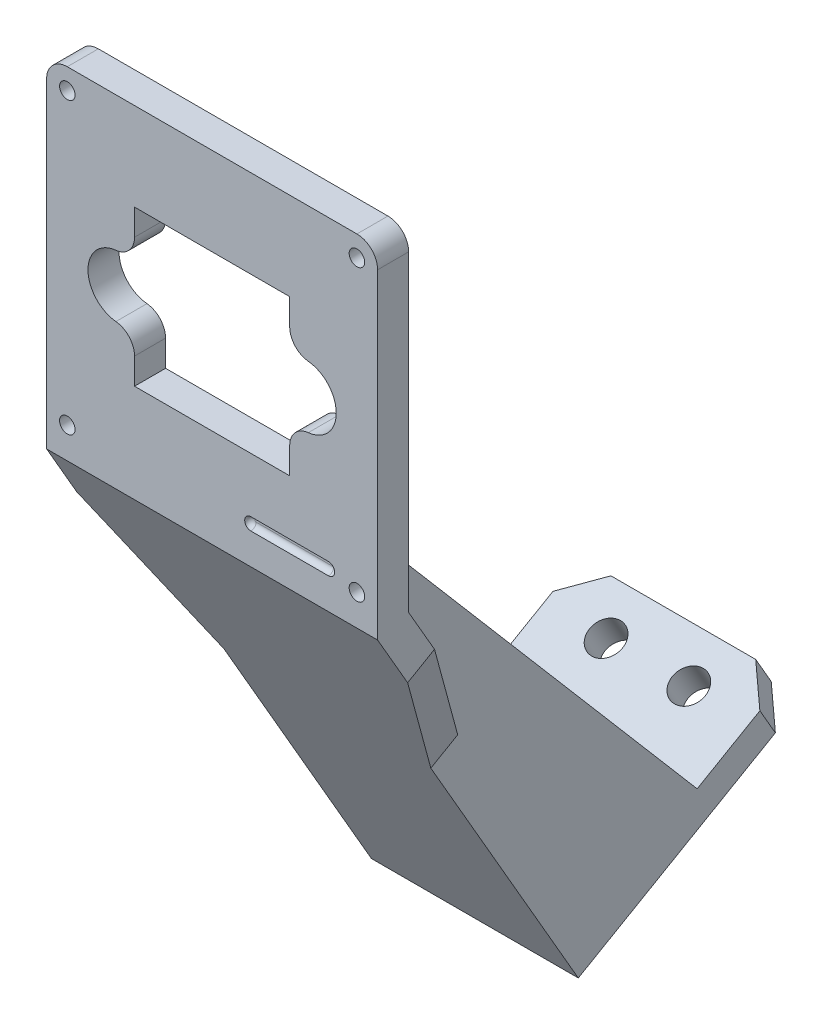
from build123d import *

# Parameters (mm, degrees)
BOSS_EXTRUDE1_DEPTH = 16
FILLET1_R           = 2
SKETCH2_W           = 15
SKETCH2_H           = 4.5
SKETCH2_H_2         = 6
SKETCH2_R           = 0.75
CUT_EXTRUDE1_DEPTH  = 32
SKETCH4_R           = 1.6
CUT_EXTRUDE2_DEPTH  = 92
CUT_EXTRUDE4_DEPTH  = 80.584099309
BOSS_EXTRUDE2_DEPTH = 3
DRAFT1_ANGLE        = 70
DRAFT2_START        = -8.5
DRAFT2_DEPTH        = 3
CUT_EXTRUDE5_DEPTH  = 0.5
FILLET4_R           = 0.5
FILLET3_R           = 2
CHAMFER1_SIZE       = 3


# Read off the part's stored shape, not the designer's step: Draft2
with BuildPart() as part:
    # Sketch1 → Boss-Extrude1 (new, symmetric)
    with BuildSketch(Plane(origin=(0, 0, 0), x_dir=(0, 0, -1), z_dir=(1, 0, 0))):
        Polygon((0, 16), (0, -17), (25.401923789, -60.997422612), (47.052558883, -48.497422612), (45.552558883, -45.899346401), (26.5, -56.899346401), (3, -16.196152423), (3, 16), align=None)
    extrude(amount=BOSS_EXTRUDE1_DEPTH, both=True)

    # Fillet1
    fillet1_edges = [part.edges().sort_by_distance(p)[0] for p in [
        (-16, 16, -1.5),
        (16, 16, -1.5),
    ]]
    fillet(fillet1_edges, radius=FILLET1_R)

    # Sketch2 → Cut-Extrude1 (cut)
    with BuildSketch(Plane(origin=(0, 0, -3), x_dir=(-1, 0, 0), z_dir=(0, 0, -1))):
        with Locations((0, 5.25)):
            Rectangle(SKETCH2_W, SKETCH2_H)
        Rectangle(SKETCH2_W, SKETCH2_H_2)
        with BuildLine():
            Line((-9, -3), (-7.5, -3))
            Line((-7.5, -3), (-7.5, 3))
            Line((-7.5, 3), (-9, 3))
            ThreePointArc((-9, 3), (-12, 0), (-9, -3))
        make_face()
        with Locations((0, -5.25)):
            Rectangle(SKETCH2_W, SKETCH2_H)
        with BuildLine():
            Line((7.5, 3), (7.5, -3))
            Line((7.5, -3), (9, -3))
            ThreePointArc((9, -3), (12, 0), (9, 3))
            Line((9, 3), (7.5, 3))
        make_face()
        with Locations((14, -14)):
            Circle(SKETCH2_R)
        with Locations((-14, -14)):
            Circle(SKETCH2_R)
        with Locations((-14, 14)):
            Circle(SKETCH2_R)
        with Locations((14, 14)):
            Circle(SKETCH2_R)
    extrude(amount=-CUT_EXTRUDE1_DEPTH, mode=Mode.SUBTRACT)

    # Sketch4 → Cut-Extrude2 (cut)
    with BuildSketch(Plane(origin=(0, -56.747422612, -32.763139721), x_dir=(1, 0, 0), z_dir=(0, -0.8660254037844379, -0.5000000000000014))):
        with Locations(Location((-4, -12.5, 0), (0, 0, 270))):
            Circle(SKETCH4_R)
        with Locations(Location((4, -12.5, 0), (0, 0, 270))):
            Circle(SKETCH4_R)
    extrude(amount=-CUT_EXTRUDE2_DEPTH, mode=Mode.SUBTRACT)

    # Sketch7 → Cut-Extrude4 (cut, symmetric)
    with BuildSketch(Plane(origin=(0, -2.75, 4.763139721), x_dir=(-1, 0, 0), z_dir=(0, 0.500000000000002, -0.8660254037844375))):
        Polygon((-10, -65.526279442), (-10, -26.526279442), (-16, -20.526279442), (-16, -65.526279442), align=None)
    cut_extrude4 = extrude(amount=CUT_EXTRUDE4_DEPTH, both=True, mode=Mode.SUBTRACT)

    # Sketch5 → Boss-Extrude2 (add)
    with BuildSketch(Plane(origin=(10, 0, 0), x_dir=(0, 0, -1), z_dir=(1, 0, 0))):
        Polygon((36.892304845, -50.899346401), (3, -11.196152423), (3, -16.196152423), (26.5, -56.899346401), align=None)
    boss_extrude2 = extrude(amount=-BOSS_EXTRUDE2_DEPTH)

    # Draft1
    draft1_faces = [part.faces().sort_by_distance(p)[0] for p in [
        (13, -23.874355653, -5.700961894),
    ]]
    draft(draft1_faces, Plane(origin=(16, 0, 0), x_dir=(0, 0, 1), z_dir=(1, 0, 0)), DRAFT1_ANGLE)

    # Mirror2: Cut-Extrude4, Boss-Extrude2 across plane
    add(cut_extrude4.mirror(Plane(origin=(0, 0, 0), x_dir=(0, 0, 1), z_dir=(1, 0, 0))), mode=Mode.SUBTRACT)
    add(boss_extrude2.mirror(Plane(origin=(0, 0, 0), x_dir=(0, 0, 1), z_dir=(1, 0, 0))))

    # Draft2 outline → Draft2 (add)
    with BuildSketch(Plane(origin=(0, 0, 0), x_dir=(1, 0, 0), z_dir=(0, 0.5000000000000018, -0.8660254037844377)).offset(DRAFT2_START)):
        Polygon((-10, 26.526279442), (-10, 37.011143958), (-16, 20.526279442), align=None)
    extrude(amount=DRAFT2_DEPTH)

    # Sketch8 → Cut-Extrude5 (cut)
    with BuildSketch(Plane.XY):
        with BuildLine():
            Line((3.75, -12.8), (11.25, -12.8))
            ThreePointArc((11.25, -12.8), (11.85, -13.4), (11.25, -14))
            Line((11.25, -14), (3.75, -14))
            ThreePointArc((3.75, -14), (3.15, -13.4), (3.75, -12.8))
        make_face()
    extrude(amount=-CUT_EXTRUDE5_DEPTH, mode=Mode.SUBTRACT)

    # Fillet4
    fillet4_edges = [part.edges().sort_by_distance(p)[0] for p in [
        (7.5, -12.8, -0.5),
        (11.85, -13.4, -0.5),
        (7.5, -14, -0.5),
        (3.15, -13.4, -0.5),
    ]]
    fillet(fillet4_edges, radius=FILLET4_R - 0.0001)  # a hair under: the kernel refuses the full size

    # Fillet3
    fillet3_edges = [part.edges().sort_by_distance(p)[0] for p in [
        (-7.5, 3, -1.5),
        (-7.5, -3, -1.5),
        (7.5, -3, -1.5),
        (7.5, 3, -1.5),
    ]]
    fillet(fillet3_edges, radius=FILLET3_R)

    # Chamfer1
    chamfer1_edges = [part.edges().sort_by_distance(p)[0] for p in [
        (10, -47.198384506, -46.302558883),
        (-10, -47.198384506, -46.302558883),
    ]]
    chamfer(chamfer1_edges, length=CHAMFER1_SIZE)


solid = part.part
